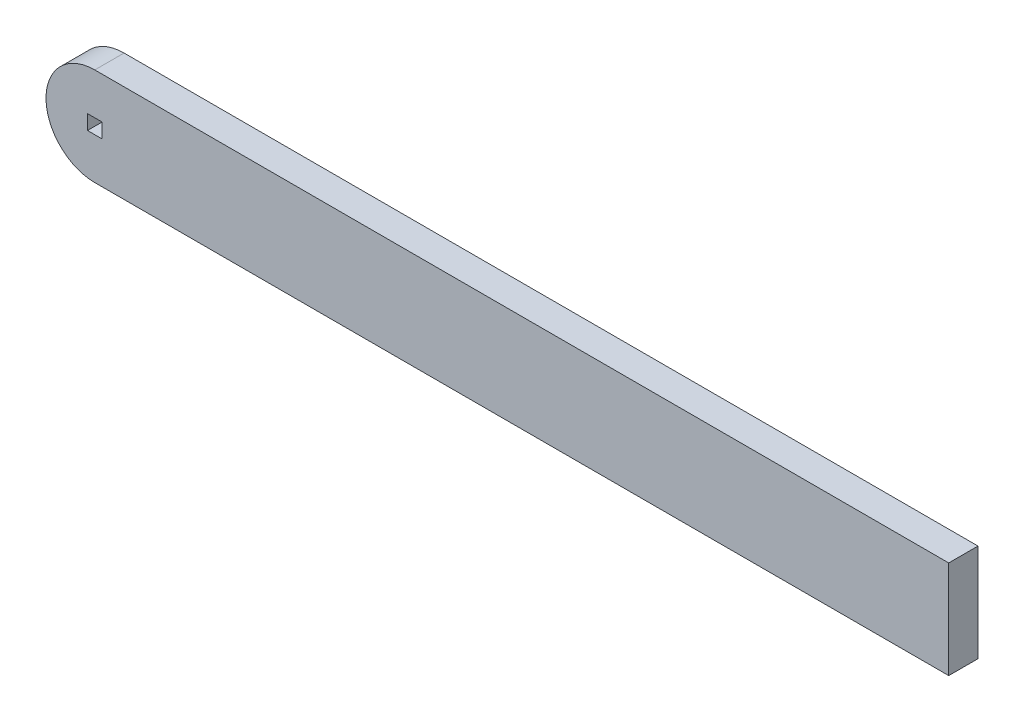
from build123d import *

# Parameters (mm, degrees)
SKETCH1_W           = 185
SKETCH1_H           = 20
BOSS_EXTRUDE1_DEPTH = 6
SKETCH2_W           = 3
SKETCH2_H           = 3
CUT_EXTRUDE2_DEPTH  = 187.174649187
FILLET1_R           = 10


with BuildPart() as part:
    # Sketch1 → Boss-Extrude1 (new body)
    with BuildSketch(Plane.XY):
        with Locations((92.5, 10)):
            Rectangle(SKETCH1_W, SKETCH1_H)
    extrude(amount=BOSS_EXTRUDE1_DEPTH)

    # Sketch2 → Cut-Extrude2 (cut, through all)
    with BuildSketch(Plane.XY.offset(6)):
        with Locations((10, 10)):
            Rectangle(SKETCH2_W, SKETCH2_H)
    extrude(amount=-CUT_EXTRUDE2_DEPTH, mode=Mode.SUBTRACT)

    # Fillet1
    fillet1_edges = [part.edges().sort_by_distance(p)[0] for p in [
        (0, 0, 3),
        (0, 20, 3),
    ]]
    fillet(fillet1_edges, radius=FILLET1_R - 0.0001)  # a hair under: the kernel refuses the full size


solid = part.part
